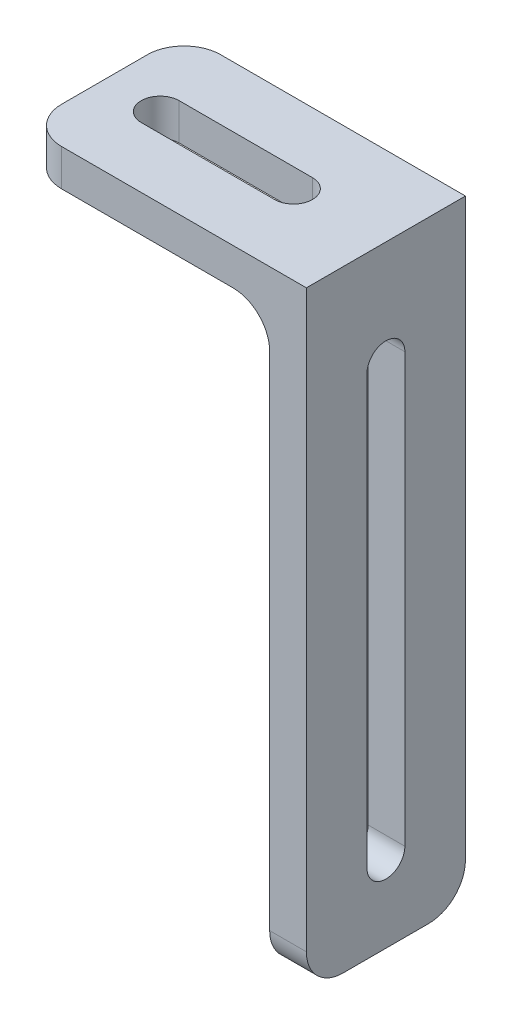
from build123d import *

# Parameters (mm, degrees)
BOSS_EXTRUDE1_DEPTH = 13
CUT_EXTRUDE1_DEPTH  = 57.55086206239477
CUT_EXTRUDE2_DEPTH  = 56.39855593785816
FILLET1_R           = 3
FILLET2_R           = 3


with BuildPart() as part:
    # Sketch1 → Boss-Extrude1 (new body)
    with BuildSketch(Plane.XY):
        Polygon((0, 0), (3, 0), (3, 50), (-20, 50), (-20, 47), (-3.47e-15, 47), align=None)
    extrude(amount=BOSS_EXTRUDE1_DEPTH)

    # Sketch6 → Cut-Extrude1 (cut, through all)
    with BuildSketch(Plane(origin=(3, 0, 0), x_dir=(0, 0, -1), z_dir=(1, 0, 0))):
        with BuildLine():
            Line((-4.949999999999999, 41.44999999999999), (-4.949999999999994, 6.449999999999983))
            ThreePointArc((-4.949999999999994, 6.449999999999983), (-6.499999999999994, 4.899999999999982), (-8.049999999999995, 6.449999999999983))
            Line((-8.049999999999995, 6.449999999999983), (-8.049999999999999, 41.44999999999999))
            ThreePointArc((-8.049999999999999, 41.44999999999999), (-6.499999999999999, 42.999999999999986), (-4.949999999999999, 41.44999999999999))
        make_face()
    extrude(amount=-CUT_EXTRUDE1_DEPTH, mode=Mode.SUBTRACT)

    # Sketch7 → Cut-Extrude2 (cut, through all)
    with BuildSketch(Plane(origin=(0, 50, 0), x_dir=(1, 0, 0), z_dir=(0, 1, 0))):
        with BuildLine():
            Line((-15.450000000000005, -4.950000000000003), (-4.550000000000002, -4.950000000000003))
            ThreePointArc((-4.550000000000002, -4.950000000000003), (-3.0000000000000044, -6.5000000000000036), (-4.550000000000002, -8.05))
            Line((-4.550000000000002, -8.05), (-15.450000000000005, -8.05))
            ThreePointArc((-15.450000000000005, -8.05), (-17.000000000000004, -6.500000000000003), (-15.450000000000005, -4.950000000000003))
        make_face()
    extrude(amount=-CUT_EXTRUDE2_DEPTH, mode=Mode.SUBTRACT)

    # Fillet1
    fillet1_edges = [part.edges().sort_by_distance(p)[0] for p in [
        (-3.47e-15, 47, 6.5),
    ]]
    fillet(fillet1_edges, radius=FILLET1_R)

    # Fillet2
    fillet2_edges = [part.edges().sort_by_distance(p)[0] for p in [
        (1.5, 0, 0),
        (1.5, 0, 13),
        (-20, 48.5, 13),
        (-20, 48.5, 0),
    ]]
    fillet(fillet2_edges, radius=FILLET2_R)


solid = part.part
